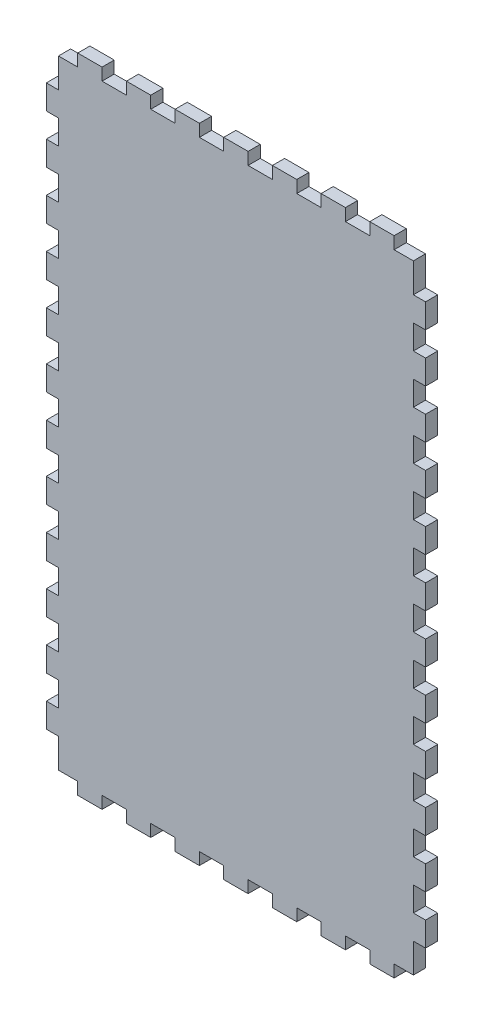
from build123d import *

# Parameters (mm, degrees)
BOSS_EXTRUDE1_DEPTH = 6


with BuildPart() as part:
    # Sketch1 → Boss-Extrude1 (new body)
    with BuildSketch(Plane.XY):
        Polygon((78, 0), (78, -6), (66, -6), (66, 0), (54, 0), (54, -6), (42, -6), (42, 0), (30, 0), (30, -6), (18, -6), (18, 0), (6, 0), (6, -6), (-6, -6), (-6, 0), (-18, 0), (-18, -6), (-30, -6), (-30, 0), (-42, 0), (-42, -6), (-54, -6), (-54, 0), (-66, 0), (-66, -6), (-78, -6), (-78, 0), (-87.5, 0), (-87.5, 14.5), (-93.5, 14.5), (-93.5, 26.5), (-87.5, 26.5), (-87.5, 38.5), (-93.5, 38.5), (-93.5, 50.5), (-87.5, 50.5), (-87.5, 62.5), (-93.5, 62.5), (-93.5, 74.5), (-87.5, 74.5), (-87.5, 86.5), (-93.5, 86.5), (-93.5, 98.5), (-87.5, 98.5), (-87.5, 110.5), (-93.5, 110.5), (-93.5, 122.5), (-87.5, 122.5), (-87.5, 134.5), (-93.5, 134.5), (-93.5, 146.5), (-87.5, 146.5), (-87.5, 158.5), (-93.5, 158.5), (-93.5, 170.5), (-87.5, 170.5), (-87.5, 182.5), (-93.5, 182.5), (-93.5, 194.5), (-87.5, 194.5), (-87.5, 206.5), (-93.5, 206.5), (-93.5, 218.5), (-87.5, 218.5), (-87.5, 230.5), (-93.5, 230.5), (-93.5, 242.5), (-87.5, 242.5), (-87.5, 254.5), (-93.5, 254.5), (-93.5, 266.5), (-87.5, 266.5), (-87.5, 278.5), (-93.5, 278.5), (-93.5, 290.5), (-87.5, 290.5), (-87.5, 305), (-78, 305), (-78, 311), (-66, 311), (-66, 305), (-54, 305), (-54, 311), (-42, 311), (-42, 305), (-30, 305), (-30, 311), (-18, 311), (-18, 305), (-6, 305), (-6, 311), (6, 311), (6, 305), (18, 305), (18, 311), (30, 311), (30, 305), (42, 305), (42, 311), (54, 311), (54, 305), (66, 305), (66, 311), (78, 311), (78, 305), (87.5, 305), (87.5, 290.5), (93.5, 290.5), (93.5, 278.5), (87.5, 278.5), (87.5, 266.5), (93.5, 266.5), (93.5, 254.5), (87.5, 254.5), (87.5, 242.5), (93.5, 242.5), (93.5, 230.5), (87.5, 230.5), (87.5, 218.5), (93.5, 218.5), (93.5, 206.5), (87.5, 206.5), (87.5, 194.5), (93.5, 194.5), (93.5, 182.5), (87.5, 182.5), (87.5, 170.5), (93.5, 170.5), (93.5, 158.5), (87.5, 158.5), (87.5, 146.5), (93.5, 146.5), (93.5, 134.5), (87.5, 134.5), (87.5, 122.5), (93.5, 122.5), (93.5, 110.5), (87.5, 110.5), (87.5, 98.5), (93.5, 98.5), (93.5, 86.5), (87.5, 86.5), (87.5, 74.5), (93.5, 74.5), (93.5, 62.5), (87.5, 62.5), (87.5, 50.5), (93.5, 50.5), (93.5, 38.5), (87.5, 38.5), (87.5, 26.5), (93.5, 26.5), (93.5, 14.5), (87.5, 14.5), (87.5, 0), align=None)
    extrude(amount=BOSS_EXTRUDE1_DEPTH)


solid = part.part
